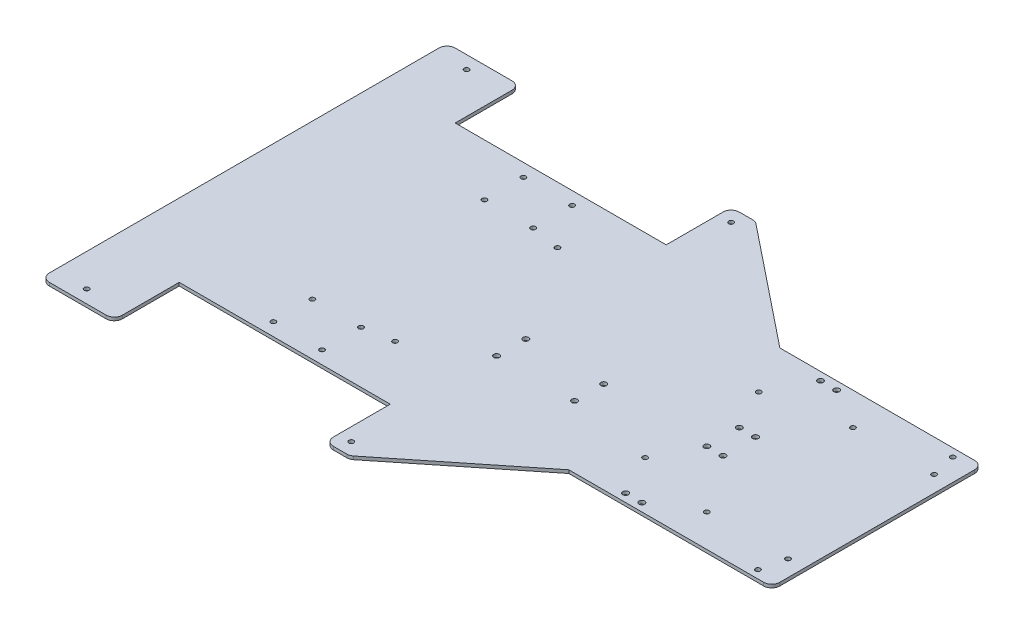
from build123d import *

# Parameters (mm, degrees)
SKETCH_1_W          = 390
SKETCH_1_H          = 250
EXTRUDE_1_DEPTH     = 2
SKETCH_2_W          = 130
SKETCH_2_H          = 40
SKETCH_2_W_2        = 125
SKETCH_2_H_2        = 60
CUT_EXTRUDE_1_DEPTH = 5
CUT_EXTRUDE_2_DEPTH = 10
FILLET_1_R          = 5
SKETCH_4_R          = 1.5
SKETCH_4_R_2        = 1.75
CUT_EXTRUDE_3_DEPTH = 232.633330935
SKETCH_5_R          = 1.75
CUT_EXTRUDE_4_DEPTH = 232.633330935
SKETCH_6_R          = 1.5
CUT_EXTRUDE_5_DEPTH = 232.633330935
SKETCH_7_R          = 1.5
CUT_EXTRUDE_6_DEPTH = 232.633330935


with BuildPart() as part:
    # 스케치1 → 보스-돌출1 (new body)
    with BuildSketch(Plane(origin=(0, 0, 0), x_dir=(1, 0, 0), z_dir=(0, 1, 0))):
        Rectangle(SKETCH_1_W, SKETCH_1_H)
    extrude(amount=EXTRUDE_1_DEPTH)

    # 스케치2 → 컷-돌출1 (cut)
    with BuildSketch(Plane(origin=(0, 2, 0), x_dir=(1, 0, 0), z_dir=(0, 1, 0))):
        with Locations((-85, 105)):
            Rectangle(SKETCH_2_W, SKETCH_2_H)
        with Locations((-85, -105)):
            Rectangle(SKETCH_2_W, SKETCH_2_H)
        with Locations((132.5, 95)):
            Rectangle(SKETCH_2_W_2, SKETCH_2_H_2)
        with Locations((132.5, -95)):
            Rectangle(SKETCH_2_W_2, SKETCH_2_H_2)
    extrude(amount=-CUT_EXTRUDE_1_DEPTH, mode=Mode.SUBTRACT)

    # 스케치3 → 컷-돌출2 (cut)
    with BuildSketch(Plane(origin=(0, 2, 0), x_dir=(1, 0, 0), z_dir=(0, 1, 0))):
        Polygon((-5, 125), (70, 65), (70, 125), align=None)
        Polygon((70, -65), (-5, -125), (70, -125), align=None)
    extrude(amount=-CUT_EXTRUDE_2_DEPTH, mode=Mode.SUBTRACT)

    # 필렛1
    fillet_1_edges = [part.edges().sort_by_distance(p)[0] for p in [
        (-20, 1, 125),
        (-20, 1, -125),
        (-5, 1, 125),
        (-5, 1, -125),
        (195, 1, -65),
        (195, 1, 65),
        (-195, 1, -125),
        (-195, 1, 125),
        (-150, 1, -125),
        (-150, 1, 125),
    ]]
    fillet(fillet_1_edges, radius=FILLET_1_R)

    # 스케치4 → 컷-돌출3 (cut, through all)
    with BuildSketch(Plane(origin=(0, 2, 0), x_dir=(1, 0, 0), z_dir=(0, 1, 0))):
        with Locations((-100, 77)):
            Circle(SKETCH_4_R)
        with Locations((-70, 77)):
            Circle(SKETCH_4_R)
        with Locations((-70, 53)):
            Circle(SKETCH_4_R)
        with Locations((-100, 53)):
            Circle(SKETCH_4_R)
        with Locations((-100, -53)):
            Circle(SKETCH_4_R)
        with Locations((-70, -53)):
            Circle(SKETCH_4_R)
        with Locations((-70, -77)):
            Circle(SKETCH_4_R)
        with Locations((-100, -77)):
            Circle(SKETCH_4_R)
        with Locations((100, 60)):
            Circle(SKETCH_4_R_2)
        with Locations((110, 60)):
            Circle(SKETCH_4_R_2)
        with Locations((100, 10)):
            Circle(SKETCH_4_R_2)
        with Locations((110, 10)):
            Circle(SKETCH_4_R_2)
        with Locations((100, -10)):
            Circle(SKETCH_4_R_2)
        with Locations((110, -10)):
            Circle(SKETCH_4_R_2)
        with Locations((100, -60)):
            Circle(SKETCH_4_R_2)
        with Locations((110, -60)):
            Circle(SKETCH_4_R_2)
    extrude(amount=-CUT_EXTRUDE_3_DEPTH, mode=Mode.SUBTRACT)

    # 스케치5 → 컷-돌출4 (cut, through all)
    with BuildSketch(Plane(origin=(0, 2, 0), x_dir=(1, 0, 0), z_dir=(0, 1, 0))):
        with Locations((-13, -8.5)):
            Circle(SKETCH_5_R)
        with Locations((35, -8.5)):
            Circle(SKETCH_5_R)
        with Locations((-13, -26.5)):
            Circle(SKETCH_5_R)
        with Locations((35, -26.5)):
            Circle(SKETCH_5_R)
    extrude(amount=-CUT_EXTRUDE_4_DEPTH, mode=Mode.SUBTRACT)

    # 스케치6 → 컷-돌출5 (cut, through all)
    with BuildSketch(Plane(origin=(0, 2, 0), x_dir=(1, 0, 0), z_dir=(0, 1, 0))):
        with Locations((135, 45)):
            Circle(SKETCH_6_R)
        with Locations((185, 45)):
            Circle(SKETCH_6_R)
        with Locations((135, -45)):
            Circle(SKETCH_6_R)
        with Locations((185, -45)):
            Circle(SKETCH_6_R)
    extrude(amount=-CUT_EXTRUDE_5_DEPTH, mode=Mode.SUBTRACT)

    # 스케치7 → 컷-돌출6 (cut, through all)
    with BuildSketch(Plane(origin=(0, 2, 0), x_dir=(1, 0, 0), z_dir=(0, 1, 0))):
        with Locations((-12, 117)):
            Circle(SKETCH_7_R)
        with Locations((-12, -117)):
            Circle(SKETCH_7_R)
        with Locations((181.5, 60)):
            Circle(SKETCH_7_R)
        with Locations((181.5, -60)):
            Circle(SKETCH_7_R)
        with Locations((-175, 117)):
            Circle(SKETCH_7_R)
        with Locations((-175, -117)):
            Circle(SKETCH_7_R)
        with Locations((87, 35)):
            Circle(SKETCH_7_R)
        with Locations((87, -35)):
            Circle(SKETCH_7_R)
        with Locations((-52, 50)):
            Circle(SKETCH_7_R)
        with Locations((-52, -50)):
            Circle(SKETCH_7_R)
    extrude(amount=-CUT_EXTRUDE_6_DEPTH, mode=Mode.SUBTRACT)


solid = part.part
